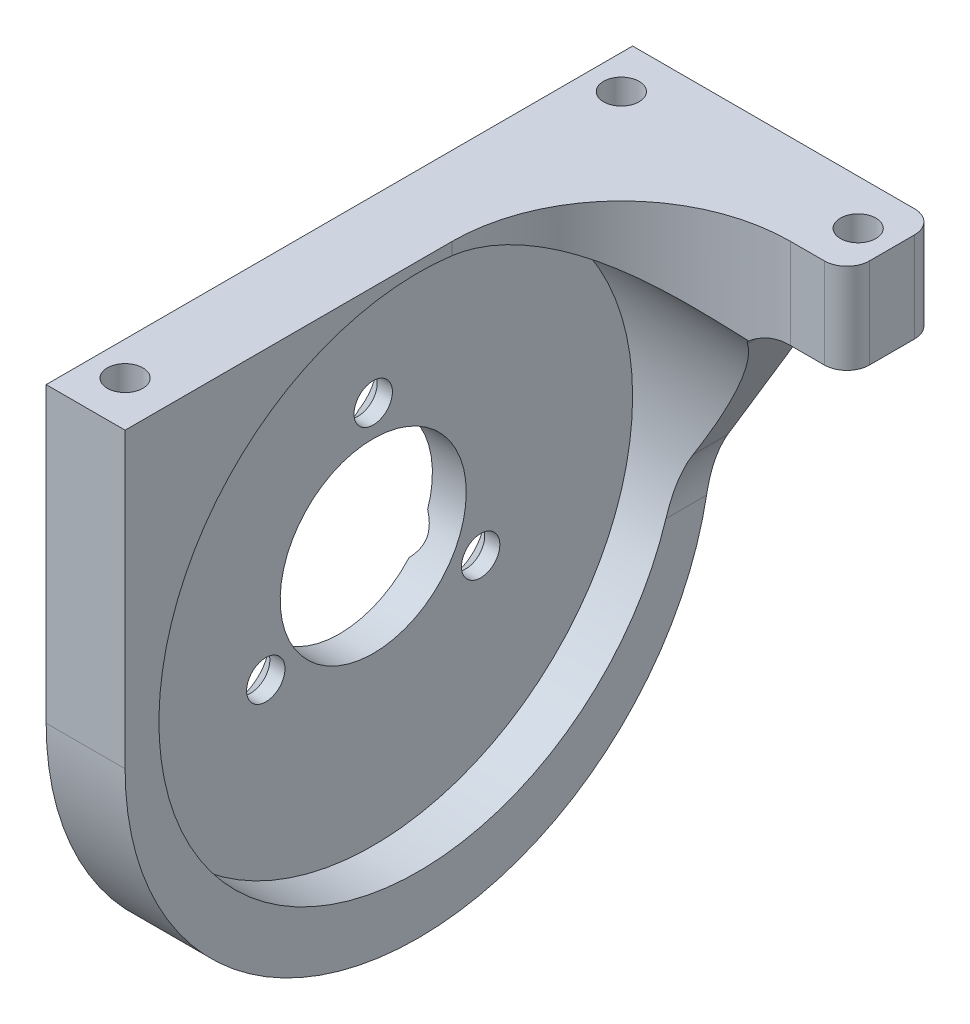
from build123d import *
from OCP.BRepFilletAPI import BRepFilletAPI_MakeChamfer

# Parameters (mm, degrees)
ESBO_O1_W                                      = 52
ESBO_O1_H                                      = 52
RESSALTO_EXTRUS_O1_DEPTH                       = 7
ESBO_O2_R                                      = 8.25
CORTE_EXTRUS_O1_DEPTH                          = 74.87151007
ESCAREADO_PARA_SFHCS_M31_D                     = 3.4
ESCAREADO_PARA_SFHCS_M31_CSINK_D               = 6.72
ESCAREADO_PARA_SFHCS_M31_CSINK_ANGLE           = 90
PADR_OCIRCULAR1_COUNT                          = 3
ESBO_O27_R                                     = 23
CORTE_EXTRUS_O5_DEPTH                          = 4
FILETE1_R                                      = 26
FURO_ROSCADO_PARA_CONDU_TE_DE_M3X0_51_AT_COUNT = 2
FURO_ROSCADO_PARA_CONDU_TE_DE_M3X0_51_AT_PITCH = 44
ESBO_O35_W                                     = 20
ESBO_O35_H                                     = 52
RESSALTO_EXTRUS_O2_DEPTH                       = 8
ESBO_O37_R                                     = 23
CORTE_EXTRUS_O6_DEPTH                          = 77.210235533
CHANFRO1_SIZE                                  = 12
CHANFRO1_SIZE2                                 = 20
FILETE2_R                                      = 10
FILETE3_R                                      = 5
CORTE_EXTRUS_O7_REACH                          = 80.339
ESBO_O39_W                                     = 20
ESBO_O39_H                                     = 36
FILETE5_R                                      = 15
FILETE6_R                                      = 2
CORTE_EXTRUS_O8_REACH                          = 80.339
ESBO_O40_W                                     = 32.243724172
ESBO_O40_H                                     = 53.230333596


with BuildPart() as part:
    # Esboço1 → Ressalto-extrusão1 (new body)
    with BuildSketch(Plane(origin=(0, 0, 0), x_dir=(0, 0, -1), z_dir=(1, 0, 0))):
        with Locations((26, 26)):
            Rectangle(ESBO_O1_W, ESBO_O1_H)
    extrude(amount=RESSALTO_EXTRUS_O1_DEPTH)

    # Esboço2 → Corte-extrusão1 (cut, through all)
    with BuildSketch(Plane.ZY):
        with Locations((-26, 28.1)):
            Circle(ESBO_O2_R)
    extrude(amount=-CORTE_EXTRUS_O1_DEPTH, mode=Mode.SUBTRACT)

    # Escareado para SFHCS M31 (through all)
    with Locations(Plane.ZY):
        with Locations((-26, 39.1)):
            escareado_para_sfhcs_m31 = CounterSinkHole(ESCAREADO_PARA_SFHCS_M31_D / 2, ESCAREADO_PARA_SFHCS_M31_CSINK_D / 2, counter_sink_angle=ESCAREADO_PARA_SFHCS_M31_CSINK_ANGLE)

    # PadrãoCircular1: Escareado para SFHCS M31 ×3 about axis
    padr_ocircular1_axis = Axis((0, 28.1, -26), (1, 0, 0))
    for i in range(1, PADR_OCIRCULAR1_COUNT):
        add(escareado_para_sfhcs_m31.rotate(padr_ocircular1_axis, i * 360 / PADR_OCIRCULAR1_COUNT), mode=Mode.SUBTRACT)

    # Esboço27 → Corte-extrusão5 (cut)
    with BuildSketch(Plane(origin=(7, 0, 0), x_dir=(0, 0, -1), z_dir=(1, 0, 0))):
        with Locations((26, 28.1)):
            Circle(ESBO_O27_R)
    extrude(amount=-CORTE_EXTRUS_O5_DEPTH, mode=Mode.SUBTRACT)

    # Filete1
    filete1_edges = [part.edges().sort_by_distance(p)[0] for p in [
        (3.5, 0, -52),
        (3.5, 0, 0),
    ]]
    fillet(filete1_edges, radius=FILETE1_R - 0.0001)  # a hair under: the kernel refuses the full size

    # Esboço34 → Furo roscado para conduíte de M3x0.51 (revolve, cut)
    with BuildSketch(Plane(origin=(3, 52, -48), x_dir=(0, 0, 1), z_dir=(1, 0, 0))):
        Polygon((0, 0), (0, 10.946355475), (1.575, 10), (1.575, 0), align=None)
    furo_roscado_para_condu_te_de_m3x0_51 = revolve(axis=Axis((3, 58.35, -48), (0, -1, 0)), mode=Mode.SUBTRACT)

    # Furo roscado para conduíte de M3x0.51 at: Furo roscado para conduíte de M3x0.51 ×2
    with Locations(*[(0, 0, i * FURO_ROSCADO_PARA_CONDU_TE_DE_M3X0_51_AT_PITCH) for i in range(1, FURO_ROSCADO_PARA_CONDU_TE_DE_M3X0_51_AT_COUNT)]):
        add(furo_roscado_para_condu_te_de_m3x0_51, mode=Mode.SUBTRACT)

    # Esboço35 → Ressalto-extrusão2 (add)
    with BuildSketch(Plane(origin=(0, 52, 0), x_dir=(1, 0, 0), z_dir=(0, 1, 0))):
        with Locations((17, 26)):
            Rectangle(ESBO_O35_W, ESBO_O35_H)
    extrude(amount=-RESSALTO_EXTRUS_O2_DEPTH)

    # Esboço37 → Corte-extrusão6 (cut, through all)
    with BuildSketch(Plane(origin=(7, 0, 0), x_dir=(0, 0, -1), z_dir=(1, 0, 0))):
        with Locations((26, 28.1)):
            Circle(ESBO_O37_R)
    extrude(amount=CORTE_EXTRUS_O6_DEPTH, mode=Mode.SUBTRACT)

    # Chanfro1: one chamfer whose edges measure the first distance from different faces: ONE call of the kernel's chamfer builder (chamfer() names one face for all edges)
    chanfro1_edges_1 = [part.edges().sort_by_distance(p)[0] for p in [
        (7, 44, -47.309482535),
    ]]
    chanfro1_side_1 = [part.faces().sort_by_distance(p)[0] for p in [
        (17, 44, -47.309482535),
    ]]
    chanfro1_edges_2 = [part.edges().sort_by_distance(p)[0] for p in [
        (7, 44, -4.690517465),
    ]]
    chanfro1_side_2 = [part.faces().sort_by_distance(p)[0] for p in [
        (17, 44, -4.690517465),
    ]]
    chanfro1 = BRepFilletAPI_MakeChamfer(part.part.solid().wrapped)
    for e in chanfro1_edges_1:
        chanfro1.Add(CHANFRO1_SIZE, CHANFRO1_SIZE2, e.wrapped, chanfro1_side_1[0].wrapped)  # the first distance lies on this face
    for e in chanfro1_edges_2:
        chanfro1.Add(CHANFRO1_SIZE, CHANFRO1_SIZE2, e.wrapped, chanfro1_side_2[0].wrapped)  # the first distance lies on this face
    add(Compound.cast(chanfro1.Shape()), mode=Mode.REPLACE)

    # Filete2
    filete2_edges = [part.edges().sort_by_distance(p)[0] for p in [
        (7, 24, -1.722707367),
        (7, 24, -50.277292633),
    ]]
    fillet(filete2_edges, radius=FILETE2_R)

    # Filete3
    filete3_edges = [part.edges().sort_by_distance(p)[0] for p in [
        (19, 44, -4.690517465),
        (19, 44, -47.309482535),
    ]]
    fillet(filete3_edges, radius=FILETE3_R)

    # Espelhar1: Furo roscado para conduíte de M3x0.51 across plane
    add(furo_roscado_para_condu_te_de_m3x0_51.mirror(Plane.ZY.offset(-13.5)), mode=Mode.SUBTRACT)

    # Espelhar1 copy 1 sketch → Espelhar1 copy 1 (revolve, cut)
    with BuildSketch(Plane(origin=(24, 52, -4), x_dir=(0, 0, 1), z_dir=(-1, 0, 0))):
        Polygon((0, 0), (0, -10.946355475), (1.575, -10), (1.575, 0), align=None)
    revolve(axis=Axis((24, 58.35, -4), (0, 1, 0)), mode=Mode.SUBTRACT)

    # Esboço39 → Corte-extrusão7 (cut, up to next)
    with BuildSketch(Plane(origin=(0, 52, 0), x_dir=(1, 0, 0), z_dir=(0, 1, 0)), mode=Mode.PRIVATE) as corte_extrus_o7_sk1:
        with Locations((17, 26)):
            Rectangle(ESBO_O39_W, ESBO_O39_H)
    corte_extrus_o7_tool1 = extrude(corte_extrus_o7_sk1.sketch, amount=-CORTE_EXTRUS_O7_REACH, mode=Mode.PRIVATE) & part.part
    add(corte_extrus_o7_tool1.solids().sort_by_distance((17, 52, -26))[0], mode=Mode.SUBTRACT)

    # Filete5
    filete5_edges = [part.edges().sort_by_distance(p)[0] for p in [
        (7, 47.208910532, -44),
        (7, 47.208910532, -8),
    ]]
    fillet(filete5_edges, radius=FILETE5_R)

    # Filete6
    filete6_edges = [part.edges().sort_by_distance(p)[0] for p in [
        (27, 48, -44),
        (27, 48, -8),
        (27, 48, -52),
        (27, 48, 0),
    ]]
    fillet(filete6_edges, radius=FILETE6_R)

    # Esboço40 → Corte-extrusão8 (cut, up to next)
    with BuildSketch(Plane.XY, mode=Mode.PRIVATE) as corte_extrus_o8_sk1:
        with Locations((23.121862086, 26.615166798)):
            Rectangle(ESBO_O40_W, ESBO_O40_H)
    corte_extrus_o8_tool1 = extrude(corte_extrus_o8_sk1.sketch, amount=-CORTE_EXTRUS_O8_REACH, mode=Mode.PRIVATE) & part.part
    add(corte_extrus_o8_tool1.solids().sort_by_distance((23.121862, 26.615167, 0))[0], mode=Mode.SUBTRACT)


solid = part.part
